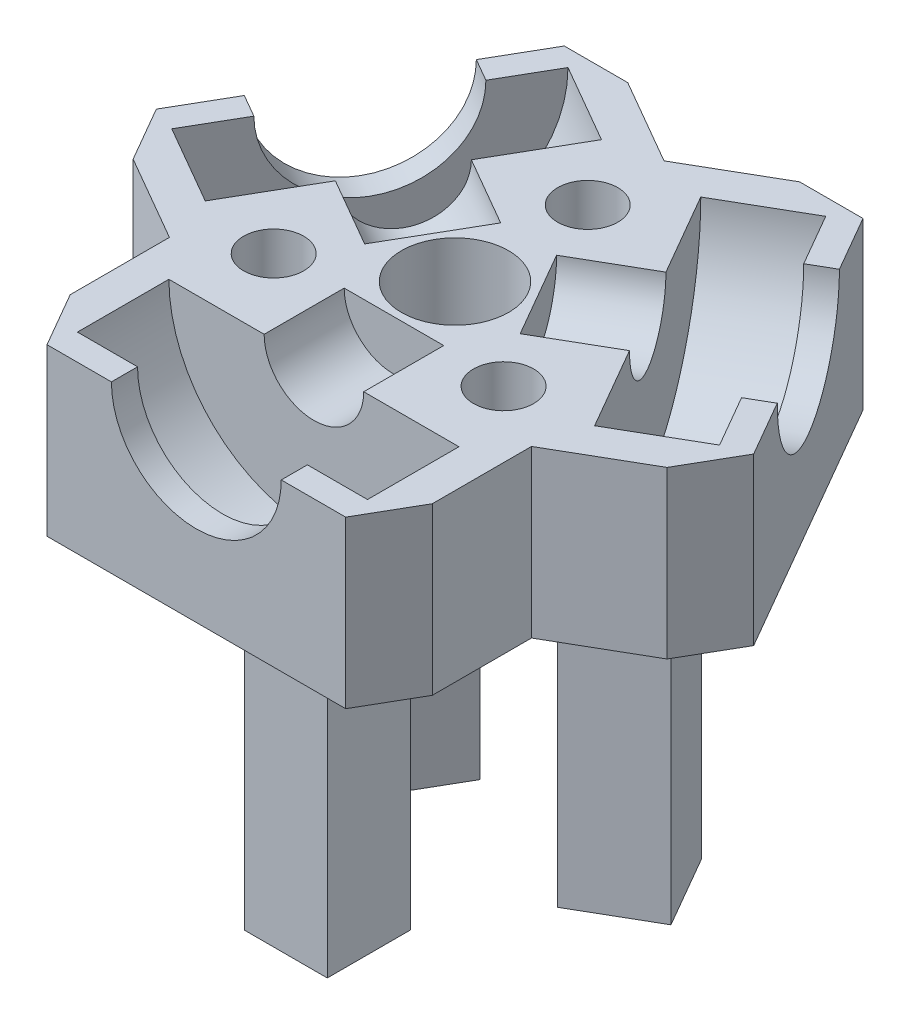
from build123d import *

# Parameters (mm, degrees)
BOSS_EXTRUDE1_DEPTH = 12.7
SKETCH2_R           = 7.100000009
SKETCH2_R_2         = 4.100000009
BOSS_EXTRUDE2_DEPTH = 3.499999906
SKETCH4_W           = 6.35
SKETCH4_H           = 6.35
BOSS_EXTRUDE4_DEPTH = 25.4
CIRPATTERN1_COUNT   = 3
SKETCH6_R           = 4.100000009
CUT_EXTRUDE1_DEPTH  = 49.642823726
SKETCH7_R           = 2.3
CUT_EXTRUDE2_DEPTH  = 5.7
CUT_EXTRUDE4_DEPTH  = 49.642823726


with BuildPart() as part:
    # Sketch1 → Boss-Extrude1 (new body)
    with BuildSketch(Plane(origin=(0, 0, 0), x_dir=(1, 0, 0), z_dir=(0, 1, 0))):
        Polygon((11.43, -19.797340731), (22.86, 0), (11.43, 19.797340731), (-11.43, 19.797340731), (-22.86, 0), (-11.43, -19.797340731), align=None)
    extrude(amount=BOSS_EXTRUDE1_DEPTH)

    # Sketch2 → Boss-Extrude2 (add)
    with BuildSketch(Plane.XZ):
        Circle(SKETCH2_R)
        Circle(SKETCH2_R_2, mode=Mode.SUBTRACT)
    extrude(amount=BOSS_EXTRUDE2_DEPTH)

    # Sketch4 → Boss-Extrude4 (add)
    with BuildSketch(Plane.XZ):
        Polygon((12.802528987, -3.725369347), (7.303267673, -0.550369347), (4.128267673, -6.049630662), (9.627528987, -9.224630662), align=None)
        with Locations((0, 9.775000009)):
            Rectangle(SKETCH4_W, SKETCH4_H)
        Polygon((-9.627528987, -9.224630662), (-4.128267673, -6.049630662), (-7.303267673, -0.550369347), (-12.802528987, -3.725369347), align=None)
    extrude(amount=BOSS_EXTRUDE4_DEPTH)

    # Sketch5 → Cut-Revolve1 (revolve, cut)
    with BuildSketch(Plane(origin=(0, 12.7, 0), x_dir=(1, 0, 0), z_dir=(0, 1, 0))):
        Polygon((0, -19.797340731), (0, -4.672340739), (-3.81, -4.672340739), (-3.81, -10.797340731), (-11.100000152, -10.797340731), (-11.100000152, -17.797340731), (-6.5, -17.797340731), (-6.5, -19.797340731), align=None)
    cut_revolve1 = revolve(axis=Axis((0, 12.7, 19.797340731), (0, 0, -1)), mode=Mode.SUBTRACT)

    # CirPattern1: Cut-Revolve1 ×3 about axis
    cirpattern1_axis = Axis((0, -3.499999906, 0), (0, 1, 0))
    for i in range(1, CIRPATTERN1_COUNT):
        add(cut_revolve1.rotate(cirpattern1_axis, i * 360 / CIRPATTERN1_COUNT), mode=Mode.SUBTRACT)

    # Sketch6 → Cut-Extrude1 (cut, through all)
    with BuildSketch(Plane(origin=(0, 12.7, 0), x_dir=(1, 0, 0), z_dir=(0, 1, 0))):
        Circle(SKETCH6_R)
    extrude(amount=-CUT_EXTRUDE1_DEPTH, mode=Mode.SUBTRACT)

    # Sketch7 → Cut-Extrude2 (cut)
    with BuildSketch(Plane(origin=(0, 12.7, 0), x_dir=(1, 0, 0), z_dir=(0, 1, 0))):
        with Locations((0, 10.16)):
            Circle(SKETCH7_R)
        with Locations((8.798818102, -5.08)):
            Circle(SKETCH7_R)
        with Locations((-8.798818102, -5.08)):
            Circle(SKETCH7_R)
    extrude(amount=-CUT_EXTRUDE2_DEPTH, mode=Mode.SUBTRACT)

    # Sketch9 → Cut-Extrude4 (cut, through all)
    with BuildSketch(Plane(origin=(0, 12.7, 0), x_dir=(1, 0, 0), z_dir=(0, 1, 0))):
        Polygon((-6.577186816, 19.797340731), (0, 16.000000152), (6.577186816, 19.797340731), align=None)
        Polygon((20.433593408, -4.202659497), (13.856406592, -8.000000076), (13.856406592, -15.594681234), align=None)
        Polygon((-13.856406592, -15.594681234), (-13.856406592, -8.000000076), (-20.433593408, -4.202659497), align=None)
    extrude(amount=-CUT_EXTRUDE4_DEPTH, mode=Mode.SUBTRACT)


solid = part.part
